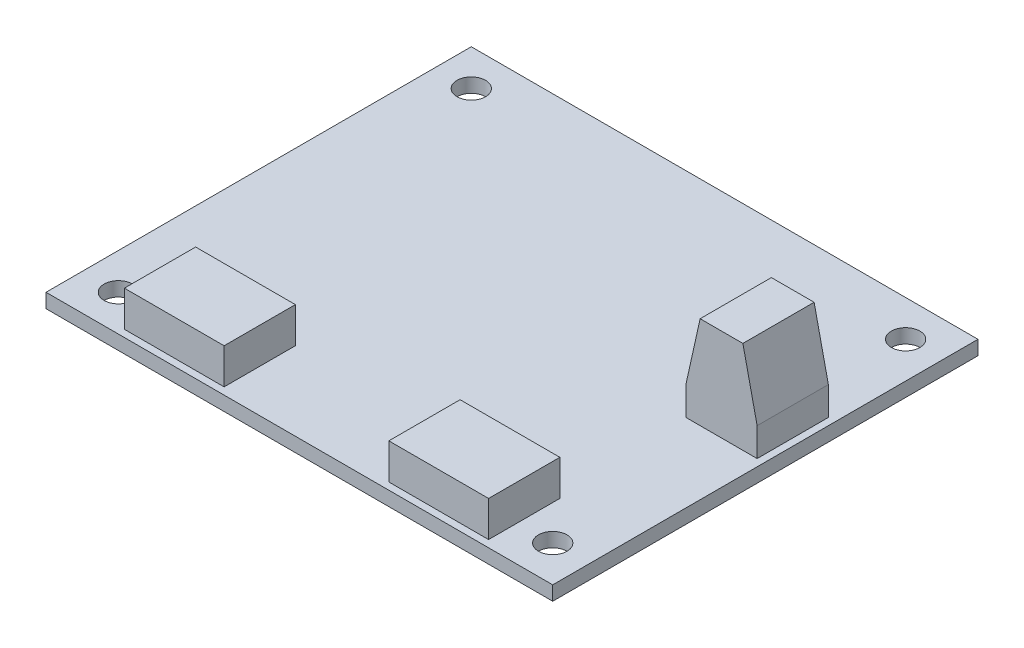
from build123d import *

# Parameters (mm, degrees)
SKETCH1_W           = 71.12
SKETCH1_H           = 59.69
BOSS_EXTRUDE1_DEPTH = 2
SKETCH2_R           = 2
CUT_EXTRUDE1_DEPTH  = 2
SKETCH3_W           = 14
SKETCH3_H           = 10
BOSS_EXTRUDE2_DEPTH = 5
SKETCH4_W           = 10
SKETCH4_H           = 10
BOSS_EXTRUDE3_DEPTH = 13
CUT_EXTRUDE2_DEPTH  = 49.882651319


with BuildPart() as part:
    # Sketch1 → Boss-Extrude1 (new body)
    with BuildSketch(Plane(origin=(0, 0, 0), x_dir=(1, 0, 0), z_dir=(0, 1, 0))):
        Rectangle(SKETCH1_W, SKETCH1_H)
    extrude(amount=BOSS_EXTRUDE1_DEPTH)

    # Sketch2 → Cut-Extrude1 (cut)
    with BuildSketch(Plane(origin=(0, 2, 0), x_dir=(1, 0, 0), z_dir=(0, 1, 0))):
        with Locations((-30.48, 24.765)):
            Circle(SKETCH2_R)
        with Locations((30.48, 24.765)):
            Circle(SKETCH2_R)
        with Locations((30.48, -24.765)):
            Circle(SKETCH2_R)
        with Locations((-30.48, -24.765)):
            Circle(SKETCH2_R)
    extrude(amount=-CUT_EXTRUDE1_DEPTH, mode=Mode.SUBTRACT)

    # Sketch3 → Boss-Extrude2 (add)
    with BuildSketch(Plane(origin=(0, 2, 0), x_dir=(1, 0, 0), z_dir=(0, 1, 0))):
        with Locations((-18.56, -23.845)):
            Rectangle(SKETCH3_W, SKETCH3_H)
        with Locations((18.56, -23.845)):
            Rectangle(SKETCH3_W, SKETCH3_H)
    extrude(amount=BOSS_EXTRUDE2_DEPTH)

    # Sketch4 → Boss-Extrude3 (add)
    with BuildSketch(Plane(origin=(0, 2, 0), x_dir=(1, 0, 0), z_dir=(0, 1, 0))):
        with Locations((29.56, 4.845)):
            Rectangle(SKETCH4_W, SKETCH4_H)
    extrude(amount=BOSS_EXTRUDE3_DEPTH)

    # Sketch7 → Cut-Extrude2 (cut, through all)
    with BuildSketch(Plane.XY.offset(0.155)):
        Polygon((26.56, 15), (24.56, 6), (24.56, 15), align=None)
        Polygon((34.56, 6), (32.56, 15), (34.56, 15), align=None)
    extrude(amount=-CUT_EXTRUDE2_DEPTH, mode=Mode.SUBTRACT)


solid = part.part
